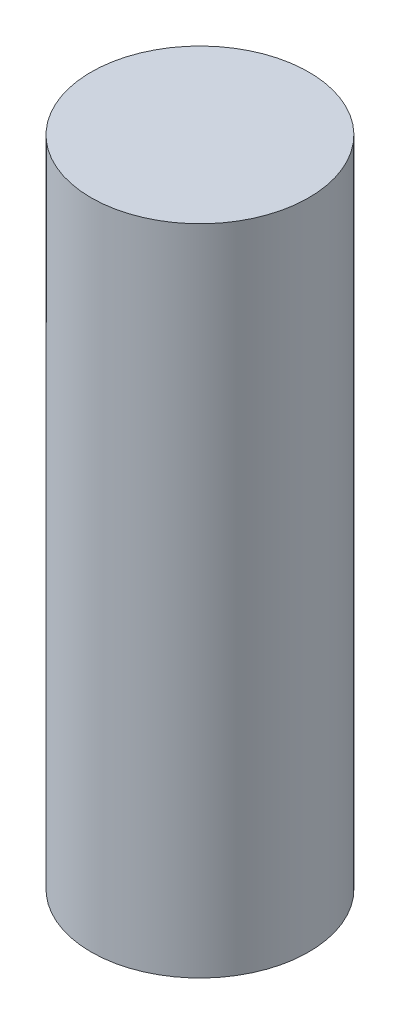
from build123d import *

# Parameters (mm, degrees)
SKETCH1_R           = 5
BOSS_EXTRUDE1_DEPTH = 30
SKETCH2_R           = 1.8
CUT_EXTRUDE1_DEPTH  = 3


with BuildPart() as part:
    # Sketch1 → Boss-Extrude1 (new body)
    with BuildSketch(Plane(origin=(0, 0, 0), x_dir=(1, 0, 0), z_dir=(0, 1, 0))):
        Circle(SKETCH1_R)
    extrude(amount=BOSS_EXTRUDE1_DEPTH)

    # Sketch2 → Cut-Extrude1 (cut)
    with BuildSketch(Plane.XZ):
        Circle(SKETCH2_R)
    extrude(amount=-CUT_EXTRUDE1_DEPTH, mode=Mode.SUBTRACT)


solid = part.part
